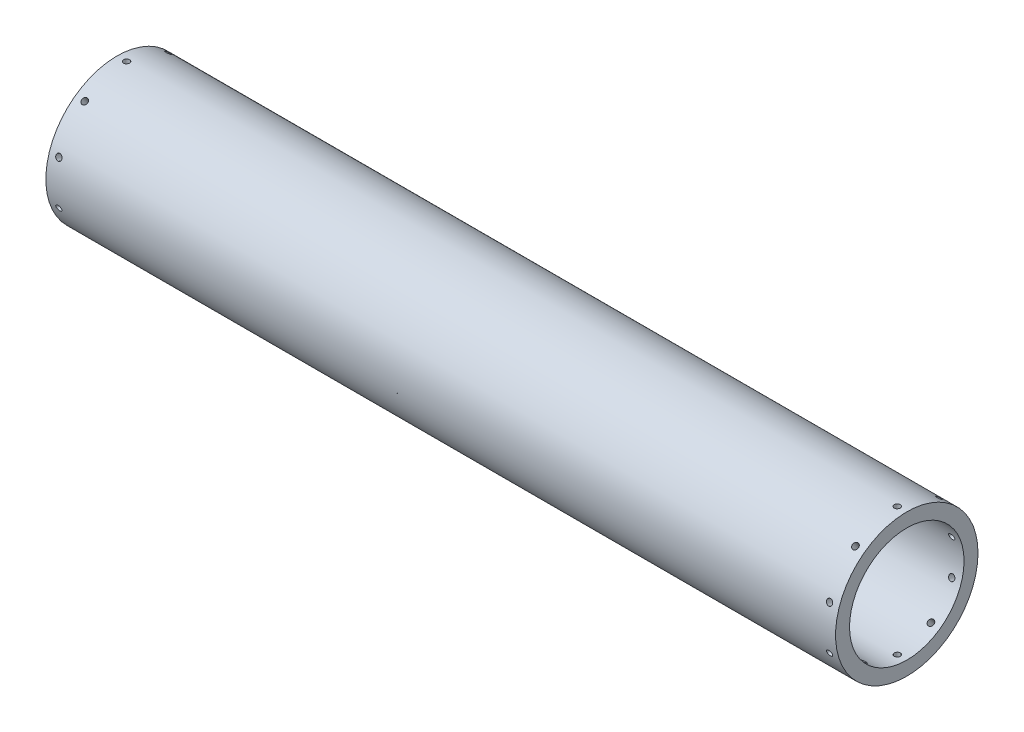
from build123d import *

# Parameters (mm, degrees)
SKETCH1_R           = 57.15
SKETCH1_R_2         = 45.9486
BOSS_EXTRUDE1_DEPTH = 633.73
SKETCH2_R           = 45.9486
SKETCH2_R_2         = 44.577
BOSS_EXTRUDE2_DEPTH = 91.44
SKETCH6_R           = 2.413
CUT_EXTRUDE1_DEPTH  = 15.24
CIRPATTERN1_COUNT   = 10
SKETCH7_R           = 2.413
CUT_EXTRUDE2_DEPTH  = 15.24
CIRPATTERN2_COUNT   = 10


with BuildPart() as part:
    # Sketch1 → Boss-Extrude1 (new body)
    with BuildSketch(Plane(origin=(0, 0, 0), x_dir=(0, 0, -1), z_dir=(1, 0, 0))):
        Circle(SKETCH1_R)
        Circle(SKETCH1_R_2, mode=Mode.SUBTRACT)
    extrude(amount=BOSS_EXTRUDE1_DEPTH)

    # Sketch2 → Boss-Extrude2 (add)
    with BuildSketch(Plane.ZY):
        Circle(SKETCH2_R)
        Circle(SKETCH2_R_2, mode=Mode.SUBTRACT)
    extrude(amount=-BOSS_EXTRUDE2_DEPTH)

    # Sketch6 → Cut-Extrude1 (cut)
    with BuildSketch(Plane(origin=(0, 57.15, 0), x_dir=(1, 0, 0), z_dir=(0, 1, 0))):
        with Locations((7.62, 0)):
            Circle(SKETCH6_R)
    cut_extrude1 = extrude(amount=-CUT_EXTRUDE1_DEPTH, mode=Mode.SUBTRACT)

    # CirPattern1: Cut-Extrude1 ×10 about axis
    cirpattern1_axis = Axis((0, 0, 0), (-1, 0, 0))
    for i in range(1, CIRPATTERN1_COUNT):
        add(cut_extrude1.rotate(cirpattern1_axis, i * 360 / CIRPATTERN1_COUNT), mode=Mode.SUBTRACT)

    # Sketch7 → Cut-Extrude2 (cut)
    with BuildSketch(Plane(origin=(0, 57.15, 0), x_dir=(1, 0, 0), z_dir=(0, 1, 0))):
        with Locations((626.11, 0)):
            Circle(SKETCH7_R)
    cut_extrude2 = extrude(amount=-CUT_EXTRUDE2_DEPTH, mode=Mode.SUBTRACT)

    # CirPattern2: Cut-Extrude2 ×10 about axis
    cirpattern2_axis = Axis((633.73, 0, 0), (1, 0, 0))
    for i in range(1, CIRPATTERN2_COUNT):
        add(cut_extrude2.rotate(cirpattern2_axis, i * 360 / CIRPATTERN2_COUNT), mode=Mode.SUBTRACT)


solid = part.part
